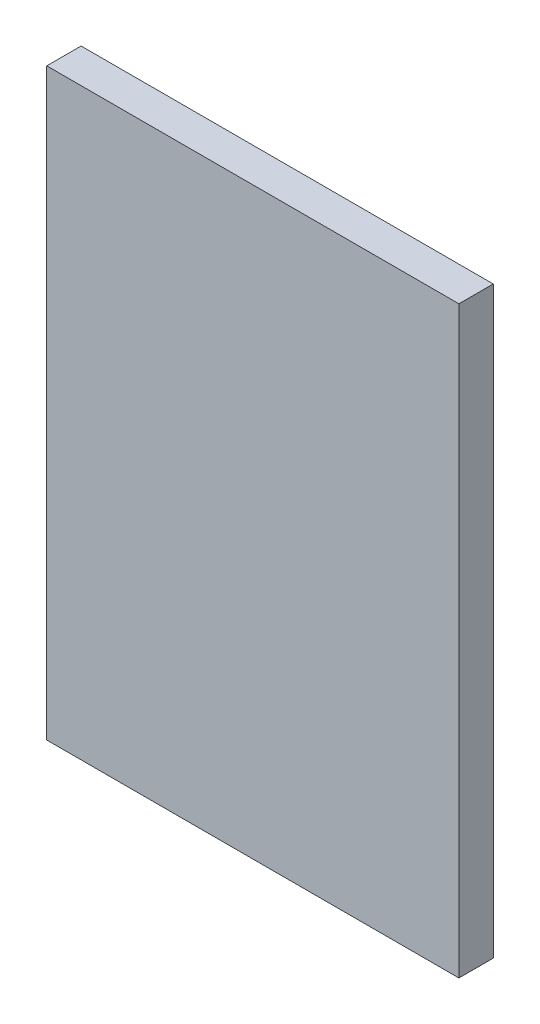
from build123d import *

# Parameters (mm, degrees)
SKETCH1_W           = 60
SKETCH1_H           = 85
BOSS_EXTRUDE1_DEPTH = 5


with BuildPart() as part:
    # Sketch1 → Boss-Extrude1 (new body)
    with BuildSketch(Plane.XY):
        with Locations((17.4651, -16.973)):
            Rectangle(SKETCH1_W, SKETCH1_H)
    extrude(amount=BOSS_EXTRUDE1_DEPTH)


solid = part.part
